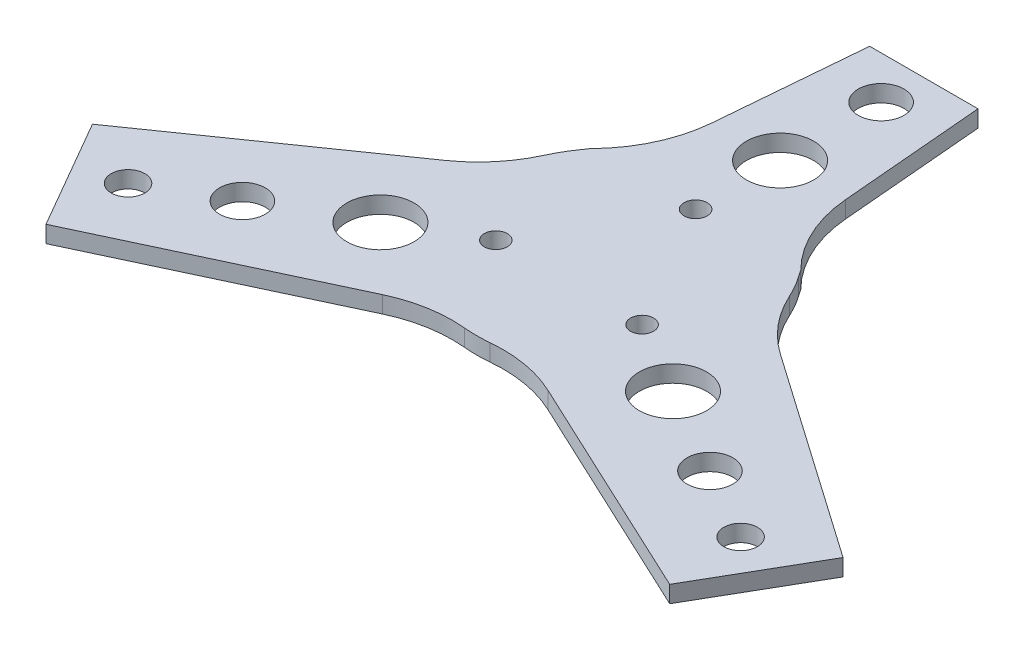
from build123d import *

# Parameters (mm, degrees)
ESBO_O2_R                = 5
ESBO_O2_R_2              = 6.8
ESBO_O2_R_3              = 10
ESBO_O2_R_4              = 3.425
RESSALTO_EXTRUS_O1_DEPTH = 5
CORTE_EXTRUS_O4_DEPTH    = 5


with BuildPart() as part:
    # Esboço2 → Ressalto-extrusão1 (new body)
    with BuildSketch(Plane(origin=(0, 0, 0), x_dir=(1, 0, 0), z_dir=(0, 1, 0))):
        with BuildLine():
            Line((-18.874646174, 118), (-25.319246319, 42.9722928))
            ThreePointArc((-25.319246319, 42.9722928), (-27.627480563, 32.598004748), (-32.586247255, 23.19776907))
            ThreePointArc((-32.586247255, 23.19776907), (-34.641016151, 20), (-36.382980953, 16.621633402))
            ThreePointArc((-36.382980953, 16.621633402), (-42.044440506, 7.627097636), (-49.874720383, 0.440964117))
            Line((-49.874720383, 0.440964117), (-111.628320734, -42.654076926))
            Line((-111.628320734, -42.654076926), (-92.753674559, -75.345923074))
            Line((-92.753674559, -75.345923074), (-24.555474064, -43.413256917))
            ThreePointArc((-24.555474064, -43.413256917), (-14.416959943, -40.225102384), (-3.796733698, -39.819402472))
            ThreePointArc((-3.796733698, -39.819402472), (0, -40), (3.796733698, -39.819402472))
            ThreePointArc((3.796733698, -39.819402472), (14.416959943, -40.225102384), (24.555474064, -43.413256917))
            Line((24.555474064, -43.413256917), (92.753674559, -75.345923074))
            Line((92.753674559, -75.345923074), (111.628320734, -42.654076926))
            Line((111.628320734, -42.654076926), (49.874720383, 0.440964117))
            ThreePointArc((49.874720383, 0.440964117), (42.044440506, 7.627097636), (36.382980953, 16.621633402))
            ThreePointArc((36.382980953, 16.621633402), (34.641016151, 20), (32.586247255, 23.19776907))
            ThreePointArc((32.586247255, 23.19776907), (27.627480563, 32.598004748), (25.319246319, 42.9722928))
            Line((25.319246319, 42.9722928), (18.874646174, 118))
            Line((18.874646174, 118), (-18.874646174, 118))
        make_face()
        with Locations((-91.096984208, -52.594868355)):
            Circle(ESBO_O2_R, mode=Mode.SUBTRACT)
        with Locations((-69.532951654, -40.144868355)):
            Circle(ESBO_O2_R_2, mode=Mode.SUBTRACT)
        with Locations((-43.50888827, -25.119868355)):
            Circle(ESBO_O2_R_3, mode=Mode.SUBTRACT)
        with Locations((91.096984208, -52.594868355)):
            Circle(ESBO_O2_R, mode=Mode.SUBTRACT)
        with Locations((69.532951654, -40.144868355)):
            Circle(ESBO_O2_R_2, mode=Mode.SUBTRACT)
        with Locations((43.50888827, -25.119868355)):
            Circle(ESBO_O2_R_3, mode=Mode.SUBTRACT)
        with Locations((21.75, -12.557368355)):
            Circle(ESBO_O2_R_4, mode=Mode.SUBTRACT)
        with Locations((-21.75, -12.557368355)):
            Circle(ESBO_O2_R_4, mode=Mode.SUBTRACT)
        with Locations((0, 25.11473671)):
            Circle(ESBO_O2_R_4, mode=Mode.SUBTRACT)
        with Locations((0, 50.23973671)):
            Circle(ESBO_O2_R_3, mode=Mode.SUBTRACT)
        with Locations((0, 80.28973671)):
            Circle(ESBO_O2_R_2, mode=Mode.SUBTRACT)
        with Locations((0, 105.18973671)):
            Circle(ESBO_O2_R, mode=Mode.SUBTRACT)
    extrude(amount=RESSALTO_EXTRUS_O1_DEPTH)

    # Esboço3 → Corte-extrusão4 (cut)
    with BuildSketch(Plane(origin=(0, 0, 0), x_dir=(1, 0, 0), z_dir=(0, 1, 0))):
        with BuildLine():
            Line((-16.11, 93), (-19.815093768, 49.865486751))
            ThreePointArc((-19.815093768, 49.865486751), (-32.621436531, 23.81900344), (-59.668341958, 13.288732092))
            Line((-59.668341958, 13.288732092), (-59.668341958, 140.154665274))
            Line((-59.668341958, 140.154665274), (59.668341958, 140.154665274))
            Line((59.668341958, 140.154665274), (59.668341958, 13.288732092))
            ThreePointArc((59.668341958, 13.288732092), (32.621436531, 23.81900344), (19.815093768, 49.865486751))
            Line((19.815093768, 49.865486751), (16.11, 93))
            Line((16.11, 93), (-16.11, 93))
        make_face()
    extrude(amount=CORTE_EXTRUS_O4_DEPTH, mode=Mode.SUBTRACT)


solid = part.part
